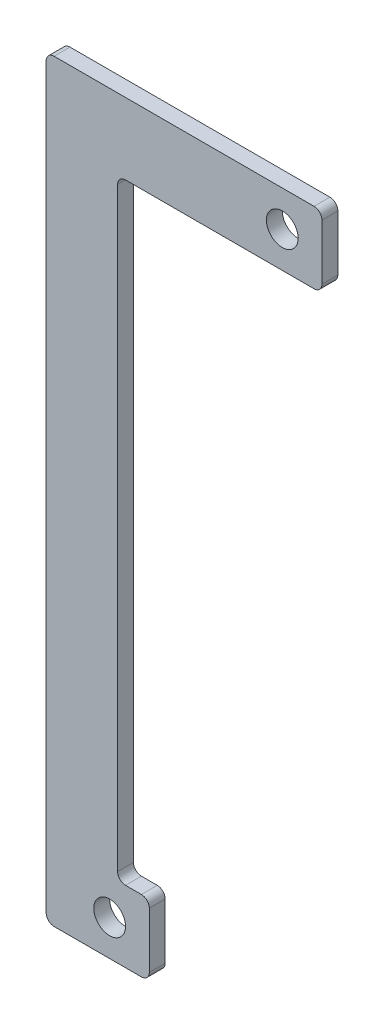
from build123d import *

# Parameters (mm, degrees)
SKETCH1_R           = 2
BOSS_EXTRUDE1_DEPTH = 2


with BuildPart() as part:
    # Sketch1 → Boss-Extrude1 (new body)
    with BuildSketch(Plane.XY):
        with BuildLine():
            Line((13, 8), (13, 1))
            ThreePointArc((13, 1), (12.707106781, 0.292893219), (12, 0))
            Line((12, 0), (1, 0))
            ThreePointArc((1, 0), (0.292893219, 0.292893219), (0, 1))
            Line((0, 1), (0, 94.000005673))
            ThreePointArc((0, 94.000005673), (0.292893219, 94.707112454), (1, 95.000005673))
            Line((1, 95.000005673), (33.760008368, 95.000005673))
            ThreePointArc((33.760008368, 95.000005673), (34.467115149, 94.707112454), (34.760008368, 94.000005673))
            Line((34.760008368, 94.000005673), (34.760008368, 87.000005673))
            ThreePointArc((34.760008368, 87.000005673), (34.467115149, 86.292898892), (33.760008368, 86.000005673))
            Line((33.760008368, 86.000005673), (10, 86.000005673))
            ThreePointArc((10, 86.000005673), (9.292893219, 85.707112454), (9, 85.000005673))
            Line((9, 85.000005673), (9, 10))
            ThreePointArc((9, 10), (9.292893219, 9.292893219), (10, 9))
            Line((10, 9), (12, 9))
            ThreePointArc((12, 9), (12.707106781, 8.707106781), (13, 8))
        make_face()
        with Locations((29.760008368, 90.500005673)):
            Circle(SKETCH1_R, mode=Mode.SUBTRACT)
        with Locations((8, 4.5)):
            Circle(SKETCH1_R, mode=Mode.SUBTRACT)
    extrude(amount=BOSS_EXTRUDE1_DEPTH)


solid = part.part
